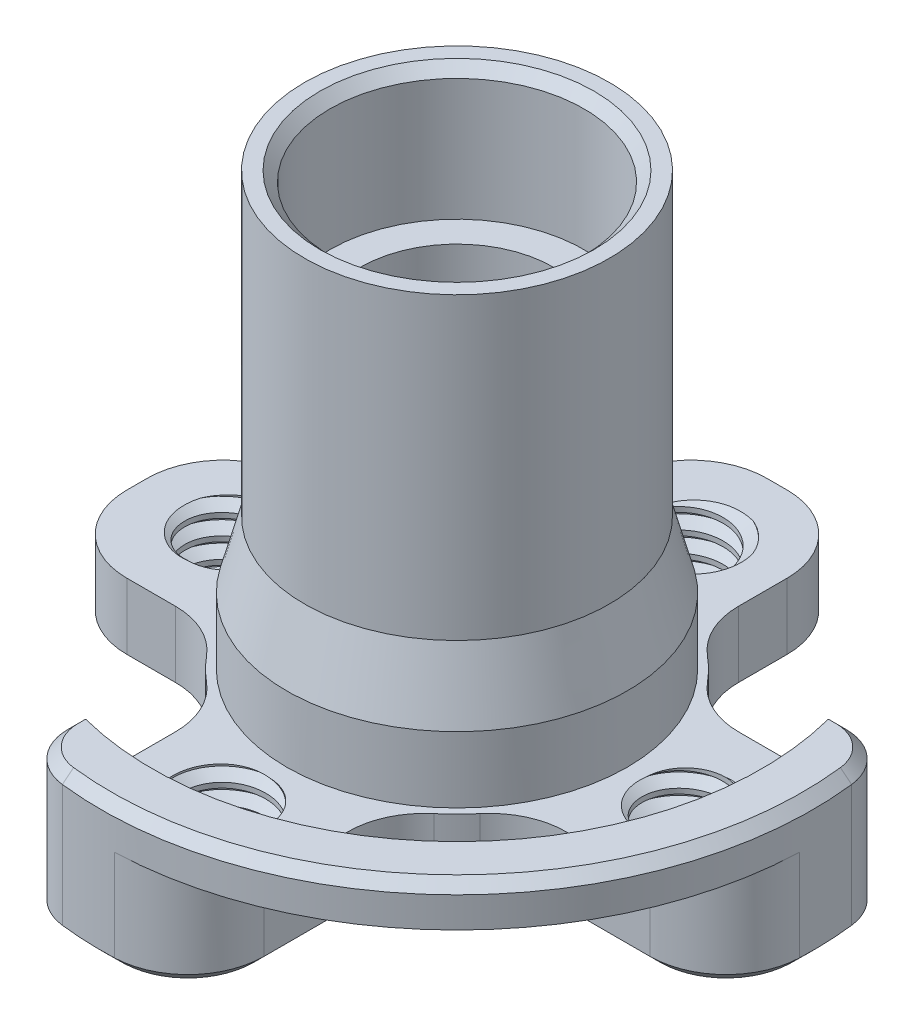
from build123d import *

# Parameters (mm, degrees)
CUT_EXTRUDE1_START = 2.8
SKETCH2_R          = 6
SKETCH2_R_2        = 3.35
CUT_EXTRUDE1_DEPTH = 1.3
CUT_EXTRUDE2_REACH = 16.071
SKETCH3_R          = 0.8
CUT_EXTRUDE3_DEPTH = 2
CUT_EXTRUDE4_REACH = 16.071
CUT_EXTRUDE5_START = 1.5
CUT_EXTRUDE5_DEPTH = 1.3
CUT_EXTRUDE6_REACH = 16.071
FILLET1_R          = 1.5
FILLET2_R          = 1
CHAMFER1_SIZE      = 0.2
THREAD1_PITCH      = 0.4
CIRPATTERN1_COUNT  = 4


with BuildPart() as part:
    # Sketch1 → Revolve1 (revolve)
    with BuildSketch(Plane.XY):
        Polygon((-2.5, 7.4), (-2.5, 10), (-3, 10), (-3, 4.106217783), (-3.35, 2.8), (-7, 2.8), (-7, 0), (-2.5, 0), (-2.5, 2.6), (-1.9, 2.6), (-1.9, 7.4), align=None)
    revolve(axis=Axis((0, 10, 0), (0, -1, 0)))

    # Sketch2 → Cut-Extrude1 (cut)
    with BuildSketch(Plane(origin=(0, 0, 0), x_dir=(1, 0, 0), z_dir=(0, 1, 0)).offset(CUT_EXTRUDE1_START)):
        with Locations(Location((0, 0, 0), (0, 0, 180))):
            Circle(SKETCH2_R)
        with Locations(Location((0, 0, 0), (0, 0, 180))):
            Circle(SKETCH2_R_2, mode=Mode.SUBTRACT)
    extrude(amount=-CUT_EXTRUDE1_DEPTH, mode=Mode.SUBTRACT)

    # Sketch3 → Cut-Extrude2 (cut, up to next)
    with BuildSketch(Plane(origin=(0, 0, 0), x_dir=(1, 0, 0), z_dir=(0, 1, 0)), mode=Mode.PRIVATE) as cut_extrude2_sk1:
        with Locations((0, 4.5)):
            Circle(SKETCH3_R)
    cut_extrude2_tool1 = extrude(cut_extrude2_sk1.sketch, amount=CUT_EXTRUDE2_REACH, mode=Mode.PRIVATE) & part.part
    # Sketch3 → Cut-Extrude2 (cut, up to next)
    with BuildSketch(Plane(origin=(0, 0, 0), x_dir=(1, 0, 0), z_dir=(0, 1, 0)), mode=Mode.PRIVATE) as cut_extrude2_sk2:
        with Locations((4.5, 0)):
            Circle(SKETCH3_R)
    cut_extrude2_tool2 = extrude(cut_extrude2_sk2.sketch, amount=CUT_EXTRUDE2_REACH, mode=Mode.PRIVATE) & part.part
    # Sketch3 → Cut-Extrude2 (cut, up to next)
    with BuildSketch(Plane(origin=(0, 0, 0), x_dir=(1, 0, 0), z_dir=(0, 1, 0)), mode=Mode.PRIVATE) as cut_extrude2_sk3:
        with Locations((0, -4.5)):
            Circle(SKETCH3_R)
    cut_extrude2_tool3 = extrude(cut_extrude2_sk3.sketch, amount=CUT_EXTRUDE2_REACH, mode=Mode.PRIVATE) & part.part
    # Sketch3 → Cut-Extrude2 (cut, up to next)
    with BuildSketch(Plane(origin=(0, 0, 0), x_dir=(1, 0, 0), z_dir=(0, 1, 0)), mode=Mode.PRIVATE) as cut_extrude2_sk4:
        with Locations((-4.5, 0)):
            Circle(SKETCH3_R)
    cut_extrude2_tool4 = extrude(cut_extrude2_sk4.sketch, amount=CUT_EXTRUDE2_REACH, mode=Mode.PRIVATE) & part.part
    add(cut_extrude2_tool1.solids().sort_by_distance((0, 0, -4.5))[0], mode=Mode.SUBTRACT)
    add(cut_extrude2_tool2.solids().sort_by_distance((4.5, 0, 0))[0], mode=Mode.SUBTRACT)
    add(cut_extrude2_tool3.solids().sort_by_distance((0, 0, 4.5))[0], mode=Mode.SUBTRACT)
    add(cut_extrude2_tool4.solids().sort_by_distance((-4.5, 0, 0))[0], mode=Mode.SUBTRACT)

    # Sketch4 → Cut-Extrude3 (cut)
    with BuildSketch(Plane(origin=(0, 0, 0), x_dir=(1, 0, 0), z_dir=(0, 1, 0))):
        with BuildLine():
            ThreePointArc((1.7, -6.790434449), (4.949747468, -4.949747468), (6.790434449, -1.7))
            Line((6.790434449, -1.7), (3.059411708, -1.7))
            ThreePointArc((3.059411708, -1.7), (2.474873734, -2.474873734), (1.7, -3.059411708))
            Line((1.7, -3.059411708), (1.7, -6.790434449))
        make_face()
    extrude(amount=CUT_EXTRUDE3_DEPTH, mode=Mode.SUBTRACT)

    # Sketch4<3> → Cut-Extrude4 (cut, up to next)
    with BuildSketch(Plane(origin=(0, 0, 0), x_dir=(1, 0, 0), z_dir=(0, 1, 0)), mode=Mode.PRIVATE) as cut_extrude4_sk1:
        with BuildLine():
            Line((-1.7, 3.059411708), (-1.7, 6.790434449))
            ThreePointArc((-1.7, 6.790434449), (-4.949747468, 4.949747468), (-6.790434449, 1.7))
            Line((-6.790434449, 1.7), (-3.059411708, 1.7))
            ThreePointArc((-3.059411708, 1.7), (-2.474873734, 2.474873734), (-1.7, 3.059411708))
        make_face()
    cut_extrude4_tool1 = extrude(cut_extrude4_sk1.sketch, amount=CUT_EXTRUDE4_REACH, mode=Mode.PRIVATE) & part.part
    # Sketch4<3> → Cut-Extrude4 (cut, up to next)
    with BuildSketch(Plane(origin=(0, 0, 0), x_dir=(1, 0, 0), z_dir=(0, 1, 0)), mode=Mode.PRIVATE) as cut_extrude4_sk2:
        with BuildLine():
            ThreePointArc((6.790434449, 1.7), (4.949747468, 4.949747468), (1.7, 6.790434449))
            Line((1.7, 6.790434449), (1.7, 3.059411708))
            ThreePointArc((1.7, 3.059411708), (2.474873734, 2.474873734), (3.059411708, 1.7))
            Line((3.059411708, 1.7), (6.790434449, 1.7))
        make_face()
    cut_extrude4_tool2 = extrude(cut_extrude4_sk2.sketch, amount=CUT_EXTRUDE4_REACH, mode=Mode.PRIVATE) & part.part
    # Sketch4<3> → Cut-Extrude4 (cut, up to next)
    with BuildSketch(Plane(origin=(0, 0, 0), x_dir=(1, 0, 0), z_dir=(0, 1, 0)), mode=Mode.PRIVATE) as cut_extrude4_sk3:
        with BuildLine():
            Line((-3.059411708, -1.7), (-6.790434449, -1.7))
            ThreePointArc((-6.790434449, -1.7), (-4.949747468, -4.949747468), (-1.7, -6.790434449))
            Line((-1.7, -6.790434449), (-1.7, -3.059411708))
            ThreePointArc((-1.7, -3.059411708), (-2.474873734, -2.474873734), (-3.059411708, -1.7))
        make_face()
    cut_extrude4_tool3 = extrude(cut_extrude4_sk3.sketch, amount=CUT_EXTRUDE4_REACH, mode=Mode.PRIVATE) & part.part
    add(cut_extrude4_tool1.solids().sort_by_distance((-3.804498, 0, -3.804498))[0], mode=Mode.SUBTRACT)
    add(cut_extrude4_tool2.solids().sort_by_distance((3.804498, 0, -3.804498))[0], mode=Mode.SUBTRACT)
    add(cut_extrude4_tool3.solids().sort_by_distance((-3.804498, 0, 3.804498))[0], mode=Mode.SUBTRACT)

    # Sketch5 → Cut-Extrude5 (cut)
    with BuildSketch(Plane(origin=(0, 0, 0), x_dir=(1, 0, 0), z_dir=(0, 1, 0)).offset(CUT_EXTRUDE5_START)):
        with BuildLine():
            Line((-6.790434449, -1.7), (-5.754128952, -1.7))
            ThreePointArc((-5.754128952, -1.7), (-6, 0), (-5.754128952, 1.7))
            Line((-5.754128952, 1.7), (-6.790434449, 1.7))
            ThreePointArc((-6.790434449, 1.7), (-7, 0), (-6.790434449, -1.7))
        make_face()
        with BuildLine():
            Line((1.7, 5.754128952), (1.7, 6.790434449))
            ThreePointArc((1.7, 6.790434449), (0, 7), (-1.7, 6.790434449))
            Line((-1.7, 6.790434449), (-1.7, 5.754128952))
            ThreePointArc((-1.7, 5.754128952), (0, 6), (1.7, 5.754128952))
        make_face()
    extrude(amount=CUT_EXTRUDE5_DEPTH, mode=Mode.SUBTRACT)

    # Sketch6 → Cut-Extrude6 (cut, up to next)
    with BuildSketch(Plane(origin=(0, 0, 0), x_dir=(1, 0, 0), z_dir=(0, 1, 0)), mode=Mode.PRIVATE) as cut_extrude6_sk1:
        with BuildLine():
            Line((-1.7, 6.3), (1.7, 6.3))
            Line((1.7, 6.3), (1.7, 6.790434449))
            ThreePointArc((1.7, 6.790434449), (0, 7), (-1.7, 6.790434449))
            Line((-1.7, 6.790434449), (-1.7, 6.3))
        make_face()
    cut_extrude6_tool1 = extrude(cut_extrude6_sk1.sketch, amount=CUT_EXTRUDE6_REACH, mode=Mode.PRIVATE) & part.part
    # Sketch6 → Cut-Extrude6 (cut, up to next)
    with BuildSketch(Plane(origin=(0, 0, 0), x_dir=(1, 0, 0), z_dir=(0, 1, 0)), mode=Mode.PRIVATE) as cut_extrude6_sk2:
        with BuildLine():
            Line((-6.3, -1.7), (-6.3, 1.7))
            Line((-6.3, 1.7), (-6.790434449, 1.7))
            ThreePointArc((-6.790434449, 1.7), (-7, 0), (-6.790434449, -1.7))
            Line((-6.790434449, -1.7), (-6.3, -1.7))
        make_face()
    cut_extrude6_tool2 = extrude(cut_extrude6_sk2.sketch, amount=CUT_EXTRUDE6_REACH, mode=Mode.PRIVATE) & part.part
    add(cut_extrude6_tool1.solids().sort_by_distance((0, 0, -6.618366))[0], mode=Mode.SUBTRACT)
    add(cut_extrude6_tool2.solids().sort_by_distance((-6.618366, 0, 0))[0], mode=Mode.SUBTRACT)

    # Fillet1
    # the kernel refuses this fillet: 1.5 mm, written as the material it adds along each edge
    with BuildSketch(Plane(origin=(3.059411708, 0, -1.7), x_dir=(1, 0, 0), z_dir=(0, 1, 0)), Plane(origin=(-1.7, 0, -3.059411708), x_dir=(0, 0, -1), z_dir=(0, 1, 0)), Plane(origin=(-3.059411708, 0, 1.7), x_dir=(-1, 0, 0), z_dir=(0, 1, 0))) as fillet1_piece_1:
        with BuildLine():
            CenterArc((0.782462834, 1.5), FILLET1_R, 219.7918195, 50.2081805)
            ThreePointArc((-0.370099528, 0.54), (-0.172396539, 0.278672134), (0, 0))
            Line((0, 0), (0.782462834, 0))
        make_face()
    extrude(amount=1.5)
    with BuildSketch(Plane(origin=(1.7, 0, -3.059411708), x_dir=(0.8248614767943058, 0, 0.5653348955271709), z_dir=(0, 1, 0)), Plane(origin=(-3.059411708, 0, -1.7), x_dir=(0.565334895527171, 0, -0.8248614767943055), z_dir=(0, 1, 0)), Plane(origin=(-1.7, 0, 3.059411708), x_dir=(-0.8248614767943054, 0, -0.5653348955271711), z_dir=(0, 1, 0)), Plane(origin=(3.059411708, 0, 1.7), x_dir=(-0.5653348955271715, 0, 0.8248614767943052), z_dir=(0, 1, 0))) as fillet1_piece_2:
        with BuildLine():
            CenterArc((0.794938671, 1.493425792), FILLET1_R, 214.425550284, 50.208180501)
            Line((-0.442353545, 0.645423449), (0, 0))
            ThreePointArc((0, 0), (0.327327688, 0.015339818), (0.654655376, 0))
        make_face()
    extrude(amount=1.5)
    with BuildSketch(Plane(origin=(1.7, 0, 3.059411708), x_dir=(0.824861476794305, 0, -0.5653348955271716), z_dir=(0, 1, 0))) as fillet1_piece_3:
        with BuildLine():
            CenterArc((0.794938671, -1.493425792), FILLET1_R, 95.366269216, 50.208180501)
            Line((-0.442353545, -0.645423449), (0, 0))
            ThreePointArc((0, 0), (0.327327688, -0.015339818), (0.654655376, 0))
        make_face()
    extrude(amount=1.5)
    # the kernel refuses this fillet: 1.5 mm, written as the material it takes off along each edge
    with BuildSketch(Plane(origin=(1.7, -3.649775314, 6.790434449), x_dir=(-0.9900983081839505, 0, 0.14037571061718293), z_dir=(0, 1, 0))) as fillet1_2_piece_1:
        with BuildLine():
            CenterArc((1.303491184, -1.491822079), FILLET1_R, 84.014354757, 87.916057665)
            Line((-0.181656279, -1.281258513), (0, 0))
            ThreePointArc((0, 0), (0.729955063, 0.038163633), (1.459910126, 0))
        make_face()
    extrude(amount=5.649775314, mode=Mode.SUBTRACT)
    with BuildSketch(Plane(origin=(6.790434449, -3.649775314, 1.7), x_dir=(-1, 0, 0), z_dir=(0, 1, 0))) as fillet1_2_piece_2:
        with BuildLine():
            CenterArc((1.294072015, -1.5), FILLET1_R, 90, 87.916057665)
            ThreePointArc((-0.204935921, -1.445454545), (-0.140253709, -0.717370026), (0, 0))
            Line((0, 0), (1.294072015, 0))
        make_face()
    extrude(amount=5.649775314, mode=Mode.SUBTRACT)
    with BuildSketch(Plane(origin=(1.7, -3.75, -6.3), x_dir=(0, 0, 1), z_dir=(0, 1, 0)), Plane(origin=(-1.7, -3.75, -6.3), x_dir=(1, 0, 0), z_dir=(0, 1, 0)), Plane(origin=(-6.3, -3.75, 1.7), x_dir=(0, 0, -1), z_dir=(0, 1, 0)), Plane(origin=(-6.3, -3.75, -1.7), x_dir=(1, 0, 0), z_dir=(0, 1, 0))) as fillet1_2_piece_3:
        with BuildLine():
            CenterArc((FILLET1_R, -FILLET1_R), FILLET1_R, 90, 90)
            Line((0, -FILLET1_R), (0, 0))
            Line((0, 0), (FILLET1_R, 0))
        make_face()
    extrude(amount=9, mode=Mode.SUBTRACT)

    # Fillet2
    fillet2_edges = [part.edges().sort_by_distance(p)[0] for p in [
        (-1.7, 1.4, 6.790434449),
        (6.790434449, 1.4, -1.7),
    ]]
    fillet(fillet2_edges, radius=FILLET2_R)

    # Chamfer1
    chamfer1_edges = [part.edges().sort_by_distance(p)[0] for p in [
        (2.5, 0, 0),
        (4.669118488, 0, 1.7),
        (2.474873734, 0, 2.474873734),
        (1.7, 0, 4.669118488),
        (2.474873734, 0, -2.474873734),
        (1.7, 0, -4.320937271),
        (-2.474873734, 0, -2.474873734),
        (-1.7, 0, -4.320937271),
        (-4.320937271, 0, -1.7),
        (-2.474873734, 0, 2.474873734),
        (-4.320937271, 0, 1.7),
        (0, 0, -6.3),
        (6.994321909, 0, -0.281888329),
        (-6.3, 0, 0),
        (-5.860660172, 0, -1.260660172),
        (-5.860660172, 0, 1.260660172),
        (-1.260660172, 0, -5.860660172),
        (1.260660172, 0, -5.860660172),
        (6.537559297, 0, 1.279772703),
        (1.279772703, 0, 6.537559297),
        (3.205478439, 0, 1.841692229),
        (1.841692229, 0, 3.205478439),
        (3.205478439, 0, -1.841692229),
        (1.841692229, 0, -3.205478439),
        (-1.841692229, 0, -3.205478439),
        (-3.205478439, 0, -1.841692229),
        (-1.841692229, 0, 3.205478439),
        (-3.205478439, 0, 1.841692229),
        (4.900450654, 0, -1.7),
        (5.856577859, 2.8, -1.7),
        (-0.281888329, 0, 6.994321909),
        (-1.7, 0, 4.900450654),
        (-1.447217059, 0, 6.623606834),
        (6.623606834, 0, -1.447217059),
        (4.949747468, 2.8, 4.949747468),
        (-1.7, 2.8, 5.856577859),
        (-1.447217059, 2.8, 6.623606834),
        (6.623606834, 2.8, -1.447217059),
        (2.5, 10, 0),
    ]]
    chamfer(chamfer1_edges, length=CHAMFER1_SIZE)

    # Thread1: arcs per turn and ends read off the stored shape
    # Thread1: the profile of Thread Profile1 profile screwed along a right-hand helix through 5.75 turns, 6 arcs to a turn; built about Z, then put on its axis
    thread1_z = Axis((0, 0, 0), (0, 0, 1))
    thread1_corners = [(0.7997, 0, -0.000173205), (1.01650635, 0, 0.124999999), (1.01650635, 0, 0.174999999), (0.7997, 0, 0.300173204)]
    with BuildLine(mode=Mode.PRIVATE) as thread1_profile:
        Line(thread1_corners[0], thread1_corners[1])
        Line(thread1_corners[1], thread1_corners[2])
        Line(thread1_corners[2], thread1_corners[3])
        Line(thread1_corners[3], thread1_corners[0])
    thread1_cap = Face(thread1_profile.wire())
    thread1_turn_angles = [0, 30, 60, 90, 120, 150, 180, 210, 240, 270, 300, 330, 360]
    thread1_turn_weights = [1, 0.8660254037844387, 1, 0.8660254037844387, 1, 0.8660254037844387, 1, 0.8660254037844387, 1, 0.8660254037844387, 1, 0.8660254037844387, 1]
    thread1_turn_rails = [Edge.make_bspline([Vector(p[0], p[1], 0).rotate(thread1_z, thread1_turn_angles[k]) / thread1_turn_weights[k] + Vector(0, 0, p[2] + THREAD1_PITCH * thread1_turn_angles[k] / 360) for k in range(13)], [0, 0, 0, 1, 1, 2, 2, 3, 3, 4, 4, 5, 5, 6, 6, 6], 2, thread1_turn_weights) for p in thread1_corners]
    thread1_turn_sides = [Face.make_surface_from_curves(thread1_turn_rails[p[0]], thread1_turn_rails[p[1]]) for p in [(0, 1), (1, 2), (2, 3), (3, 0)]]
    thread1_last_angles = [1800, 1830, 1860, 1890, 1920, 1950, 1980, 2010, 2040, 2055, 2070]
    thread1_last_weights = [1, 0.8660254037844387, 1, 0.8660254037844387, 1, 0.8660254037844387, 1, 0.8660254037844387, 1, 0.9659258262890683, 1]
    thread1_last_rails = [Edge.make_bspline([Vector(p[0], p[1], 0).rotate(thread1_z, thread1_last_angles[k]) / thread1_last_weights[k] + Vector(0, 0, p[2] + THREAD1_PITCH * thread1_last_angles[k] / 360) for k in range(11)], [0, 0, 0, 1, 1, 2, 2, 3, 3, 4, 4, 5, 5, 5], 2, thread1_last_weights) for p in thread1_corners]
    thread1_last_sides = [Face.make_surface_from_curves(thread1_last_rails[p[0]], thread1_last_rails[p[1]]) for p in [(0, 1), (1, 2), (2, 3), (3, 0)]]
    thread1 = Plane(origin=(-4.5, -0.4, 0), x_dir=(1, 0, 0), z_dir=(0, 1, 0)) * Solid(Shell([*[p.moved(Location((0, 0, THREAD1_PITCH * i))) for i in range(5) for p in thread1_turn_sides], *thread1_last_sides, thread1_cap, thread1_cap.rotate(thread1_z, 2070).moved(Location((0, 0, THREAD1_PITCH * 2070 / 360)))]))
    add(thread1, mode=Mode.SUBTRACT)

    # CirPattern1: Thread1 ×4 about axis
    cirpattern1_axis = Axis((0, 10, 0), (0, 1, 0))
    for i in range(1, CIRPATTERN1_COUNT):
        add(thread1.rotate(cirpattern1_axis, i * 360 / CIRPATTERN1_COUNT), mode=Mode.SUBTRACT)


solid = part.part
